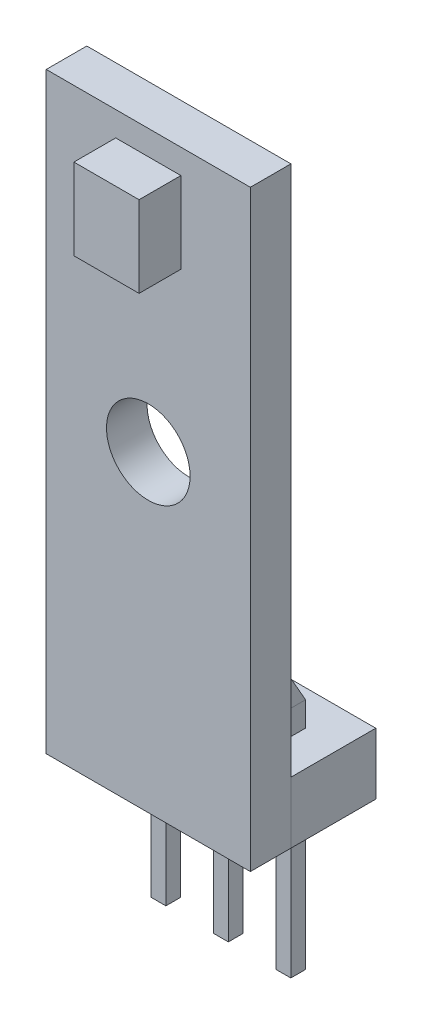
from build123d import *

# Parameters (mm, degrees)
SKETCH_1_W                   = 8.3
SKETCH_1_H                   = 24.1
EXTRUDE_1_DEPTH              = 1.65
SKETCH_2_W                   = 2.65
SKETCH_2_H                   = 3.3
EXTRUDE_2_DEPTH              = 1.7
SKETCH_3_R                   = 1.7
CUT_EXTRUDE_1_DEPTH          = 13.857488091
SKETCH_4_W                   = 8.3
SKETCH_4_H                   = 2.5
EXTRUDE_3_DEPTH              = 3.45
EXTRUDE_START                = -3.5
SKETCH_5_W                   = 0.6
SKETCH_5_H                   = 0.6
EXTRUDE_4_DEPTH              = 9.5
PATTERN_START                = -2.025
PATTERN_LINEAR_1_OUTLINE_W   = 0.6
PATTERN_LINEAR_1_OUTLINE_H   = 1
PATTERN_LINEAR_1_OUTLINE_H_2 = 6
PATTERN_LINEAR_1_DEPTH       = 0.6
EXTRUDE_5_DEPTH              = 0.6
PATTERN_LINEAR_2_COUNT       = 3
PATTERN_LINEAR_2_PITCH       = 2.54
SKETCH_7_W                   = 0.6
SKETCH_7_H                   = 0.6
EXTRUDE_6_DEPTH              = 1.5
PATTERN_LINEAR_3_COUNT       = 3
PATTERN_LINEAR_3_PITCH       = 2.54


# Read off the part's stored shape, not the designer's step: 直線複製排列1
with BuildPart() as part:
    # 草圖1 → 填料-伸長1 (new body)
    with BuildSketch(Plane.XY):
        Rectangle(SKETCH_1_W, SKETCH_1_H)
    extrude(amount=EXTRUDE_1_DEPTH)

    # 草圖3 → 除料-伸長1 (cut, through all)
    with BuildSketch(Plane.XY.offset(1.65)):
        with Locations((0, 0.65)):
            Circle(SKETCH_3_R)
    extrude(amount=-CUT_EXTRUDE_1_DEPTH, mode=Mode.SUBTRACT)



with BuildPart() as body_2:
    # 草圖2 → 填料-伸長2 (new body)
    with BuildSketch(Plane.XY.offset(1.65)):
        with Locations((0, 9.4)):
            Rectangle(SKETCH_2_W, SKETCH_2_H)
    extrude(amount=EXTRUDE_2_DEPTH)


with BuildPart() as body_3:
    # 草圖4 → 填料-伸長3 (new body)
    with BuildSketch(Plane(origin=(0, 0, 0), x_dir=(-1, 0, 0), z_dir=(0, 0, -1))):
        with Locations((0, -10.8)):
            Rectangle(SKETCH_4_W, SKETCH_4_H)
    extrude(amount=EXTRUDE_3_DEPTH)

    # 直線複製排列1 outline → 直線複製排列1 (add)
    with BuildSketch(Plane.XY.offset(PATTERN_START)):
        with Locations((-0.12, -9.05)):
            Rectangle(PATTERN_LINEAR_1_OUTLINE_W, PATTERN_LINEAR_1_OUTLINE_H)
        with Locations((-2.66, -9.05)):
            Rectangle(PATTERN_LINEAR_1_OUTLINE_W, PATTERN_LINEAR_1_OUTLINE_H)
        with Locations((-2.66, -15.05)):
            Rectangle(PATTERN_LINEAR_1_OUTLINE_W, PATTERN_LINEAR_1_OUTLINE_H_2)
        with Locations((-0.12, -15.05)):
            Rectangle(PATTERN_LINEAR_1_OUTLINE_W, PATTERN_LINEAR_1_OUTLINE_H_2)
    extrude(amount=PATTERN_LINEAR_1_DEPTH)


with BuildPart() as body_4:
    # 草圖5 → 填料-伸長4 (new body)
    with BuildSketch(Plane.XZ.offset(12.05).offset(EXTRUDE_START)):
        with Locations((2.42, -1.725)):
            Rectangle(SKETCH_5_W, SKETCH_5_H)
    extrude(amount=EXTRUDE_4_DEPTH)


with BuildPart() as body_5:
    # 草圖6 → 填料-伸長5 (new body)
    with BuildSketch(Plane.ZY.offset(2.96)):
        Polygon((-1.425, -8.55), (0, -6.05), (-0.6, -6.05), (-2.025, -8.55), align=None)
    extrude_5 = extrude(amount=-EXTRUDE_5_DEPTH)


with BuildPart() as pattern_linear_2_1:
    # 直線複製排列2: pattern copy
    add(extrude_5.moved(Location(Vector(1, 0, 0) * (1 * PATTERN_LINEAR_2_PITCH))))


with BuildPart() as pattern_linear_2_2:
    # 直線複製排列2: pattern copy
    add(extrude_5.moved(Location(Vector(1, 0, 0) * (2 * PATTERN_LINEAR_2_PITCH))))


with BuildPart() as part_1:
    add(part.part)

    add(body_5.part)  # 填料-伸長6 merges body 5
    # 草圖7 → 填料-伸長6 (add)
    with BuildSketch(Plane(origin=(0, -6.05, 0), x_dir=(1, 0, 0), z_dir=(0, 1, 0))):
        with Locations((-2.66, 0.3)):
            Rectangle(SKETCH_7_W, SKETCH_7_H)
    extrude_6 = extrude(amount=EXTRUDE_6_DEPTH)


    add(pattern_linear_2_1.part)  # 直線複製排列3 merges 直線複製排列2_1

    add(pattern_linear_2_2.part)  # 直線複製排列3 merges 直線複製排列2_2
    # 直線複製排列3: 填料-伸長6 ×3
    with Locations(*[(i * PATTERN_LINEAR_3_PITCH, 0, 0) for i in range(1, PATTERN_LINEAR_3_COUNT)]):
        add(extrude_6)


solid = Compound([body_2.part, body_3.part, body_4.part, part_1.part])
